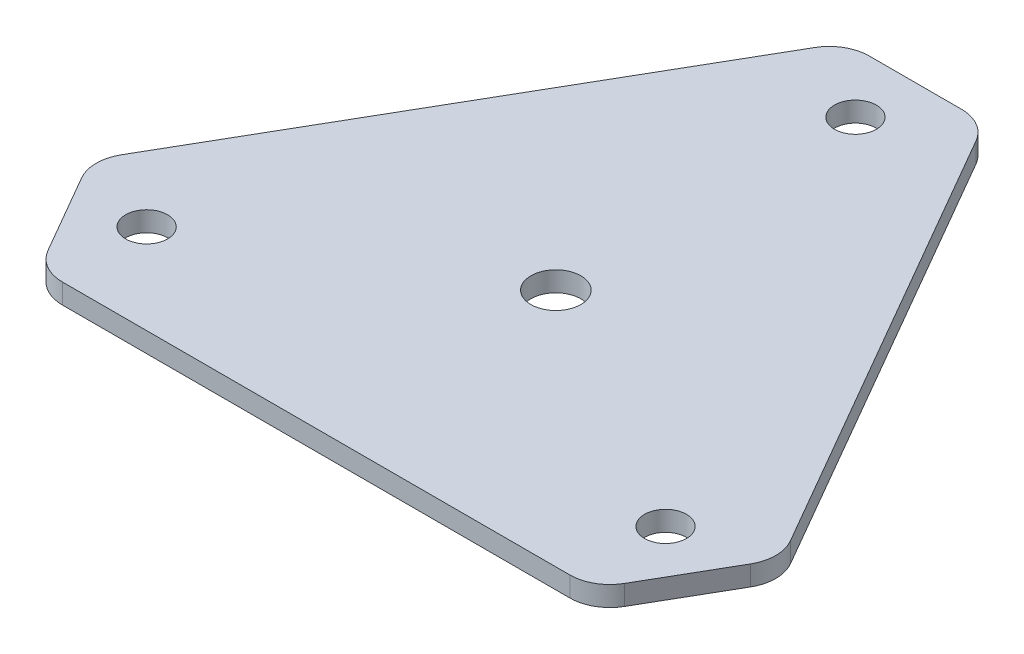
from build123d import *

# Parameters (mm, degrees)
BOSS_EXTRUDE1_DEPTH = 2
SKETCH4_R           = 2.1
CUT_EXTRUDE1_DEPTH  = 93.146808985
SKETCH5_R           = 2.5
CUT_EXTRUDE2_DEPTH  = 93.146808985
FILLET1_R           = 4


with BuildPart() as part:
    # Sketch1 → Boss-Extrude1 (new body)
    with BuildSketch(Plane(origin=(0, 0, 0), x_dir=(1, 0, 0), z_dir=(0, 1, 0))):
        Polygon((21.884903616, 49.247598816), (6.784903616, 23.093631622), (3.334903616, 17.118056336), (2.334903616, 15.386005528), (0.478497156, 12.170615219), (1.541328582, 10.329737189), (6.34386896, 2.011493249), (7.406700386, 0.170615219), (11.119513307, 0.170615219), (13.119513307, 0.170615219), (20.019513307, 0.170615219), (50.219513307, 0.170615219), (57.119513307, 0.170615219), (59.119513307, 0.170615219), (62.832326228, 0.170615219), (63.895157654, 2.011493249), (68.697698033, 10.329737189), (69.760529459, 12.170615219), (67.904122998, 15.386005528), (66.904122998, 17.118056336), (63.454122998, 23.093631622), (48.354122998, 49.247598816), (44.904122998, 55.223174102), (43.904122998, 56.95522491), (42.047716537, 60.170615219), (39.922053686, 60.170615219), (30.316972929, 60.170615219), (28.191310077, 60.170615219), (26.334903616, 56.95522491), (25.334903616, 55.223174102), align=None)
    extrude(amount=BOSS_EXTRUDE1_DEPTH)

    # Sketch4 → Cut-Extrude1 (cut, through all)
    with BuildSketch(Plane(origin=(0, 2, 0), x_dir=(1, 0, 0), z_dir=(0, 1, 0))):
        with Locations((35.119513307, 54.170615219)):
            Circle(SKETCH4_R)
        with Locations((9.138751194, 9.170615219)):
            Circle(SKETCH4_R)
        with Locations((61.100275421, 9.170615219)):
            Circle(SKETCH4_R)
    extrude(amount=-CUT_EXTRUDE1_DEPTH, mode=Mode.SUBTRACT)

    # Sketch5 → Cut-Extrude2 (cut, through all)
    with BuildSketch(Plane(origin=(0, 2, 0), x_dir=(1, 0, 0), z_dir=(0, 1, 0))):
        with Locations((35.119513307, 24.170615219)):
            Circle(SKETCH5_R)
    extrude(amount=-CUT_EXTRUDE2_DEPTH, mode=Mode.SUBTRACT)

    # Fillet1
    fillet1_edges = [part.edges().sort_by_distance(p)[0] for p in [
        (69.760529459, 1, -12.170615219),
        (62.832326228, 1, -0.170615219),
        (7.406700386, 1, -0.170615219),
        (0.478497156, 1, -12.170615219),
        (28.191310077, 1, -60.170615219),
        (42.047716537, 1, -60.170615219),
    ]]
    fillet(fillet1_edges, radius=FILLET1_R)


solid = part.part
